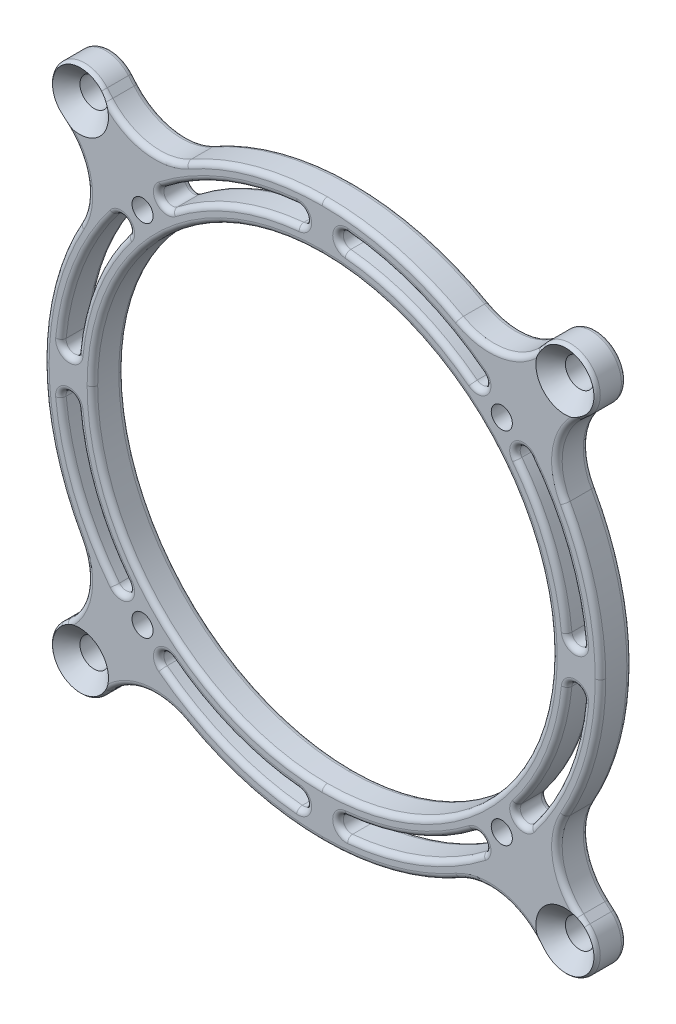
from build123d import *

# Parameters (mm, degrees)
BOSS_EXTRU_2_DEPTH                               = 3
CONG_2_R                                         = 0.5
D_GAGEMENT_M21_D                                 = 2
FRAISAGE_POUR_VIS_T_TE_FRAIS_E_M2_51_D           = 2.7
FRAISAGE_POUR_VIS_T_TE_FRAIS_E_M2_51_CSINK_D     = 5.5
FRAISAGE_POUR_VIS_T_TE_FRAIS_E_M2_51_CSINK_ANGLE = 90


# Read off the part's stored shape, not the designer's step: Symétrie1, Symétrie2
with BuildPart() as part:
    # Esquisse2 → Boss.-Extru.2 (new body)
    with BuildSketch(Plane.XY):
        with BuildLine():
            Line((24.879926139, -20.857950115), (24.281308749, -20.332585842))
            ThreePointArc((24.281308749, -20.332585842), (22.325409662, -16.837345209), (23.004734312, -12.890097263))
            ThreePointArc((23.004734312, -12.890097263), (25.514753504, -6.661063117), (26.369914832, 0))
            Line((26.369914832, 0), (21.769914832, 0))
            ThreePointArc((21.769914832, 0), (15.393654403, -15.393654403), (0, -21.769914832))
            Line((0, -21.769914832), (0, -26.369914832))
            ThreePointArc((0, -26.369914832), (6.661063117, -25.514753504), (12.890097263, -23.004734312))
            ThreePointArc((12.890097263, -23.004734312), (16.837345209, -22.325409662), (20.332585842, -24.281308749))
            Line((20.332585842, -24.281308749), (20.857950115, -24.879926139))
            ThreePointArc((20.857950115, -24.879926139), (25.015254326, -25.015254326), (24.879926139, -20.857950115))
        make_face()
        with BuildLine():
            ThreePointArc((2.376443976, -24.756113947), (9.134830733, -23.131526781), (15.179650803, -19.70002196))
            ThreePointArc((15.179650803, -19.70002196), (15.325059299, -18.578034274), (14.203071613, -18.432625777))
            ThreePointArc((14.203071613, -18.432625777), (8.547143591, -21.643365559), (2.223556024, -23.1634353))
            ThreePointArc((2.223556024, -23.1634353), (1.503660676, -24.0362186), (2.376443976, -24.756113947))
        make_face(mode=Mode.SUBTRACT)
        with BuildLine():
            ThreePointArc((24.756113947, -2.376443976), (23.131526781, -9.134830733), (19.70002196, -15.179650803))
            ThreePointArc((19.70002196, -15.179650803), (18.578034274, -15.325059299), (18.432625777, -14.203071613))
            ThreePointArc((18.432625777, -14.203071613), (21.643365559, -8.547143591), (23.1634353, -2.223556024))
            ThreePointArc((23.1634353, -2.223556024), (24.0362186, -1.503660676), (24.756113947, -2.376443976))
        make_face(mode=Mode.SUBTRACT)
    extrude(amount=BOSS_EXTRU_2_DEPTH)

    # Congé2
    cong_2_edges = [part.edges().sort_by_distance(p)[0] for p in [
        (22.325409662, -16.837345209, 0),
        (24.580617444, -20.595267979, 0),
        (25.015254326, -25.015254326, 0),
        (20.595267979, -24.580617444, 0),
        (16.837345209, -22.325409662, 0),
        (6.661063117, -25.514753504, 0),
        (15.393654403, -15.393654403, 3),
        (15.393654403, -15.393654403, 0),
        (25.514753504, -6.661063117, 0),
        (6.661063117, -25.514753504, 3),
        (16.837345209, -22.325409662, 3),
        (20.595267979, -24.580617444, 3),
        (1.503660676, -24.0362186, 0),
        (9.134830733, -23.131526781, 0),
        (15.325059299, -18.578034274, 0),
        (8.547143591, -21.643365559, 0),
        (1.503660676, -24.0362186, 3),
        (9.134830733, -23.131526781, 3),
        (15.325059299, -18.578034274, 3),
        (8.547143591, -21.643365559, 3),
        (25.015254326, -25.015254326, 3),
        (24.580617444, -20.595267979, 3),
        (22.325409662, -16.837345209, 3),
        (24.0362186, -1.503660676, 0),
        (21.643365559, -8.547143591, 0),
        (18.578034274, -15.325059299, 0),
        (23.131526781, -9.134830733, 0),
        (24.0362186, -1.503660676, 3),
        (21.643365559, -8.547143591, 3),
        (18.578034274, -15.325059299, 3),
        (23.131526781, -9.134830733, 3),
        (25.514753504, -6.661063117, 3),
    ]]
    fillet(cong_2_edges, radius=CONG_2_R)

    # Dégagement M21 (through all)
    with Locations(Plane(origin=(0, 0, 0), x_dir=(-1, 0, 0), z_dir=(0, 0, -1))):
        with Locations((-17.02, -17.02)):
            Hole(D_GAGEMENT_M21_D / 2)

    # Fraisage pour vis à tête fraisée M2.51 (through all)
    with Locations(Plane(origin=(0, 0, 3), x_dir=(-1, 0, 0), z_dir=(0, 0, 1))):
        with Locations((-23, 23)):
            CounterSinkHole(FRAISAGE_POUR_VIS_T_TE_FRAIS_E_M2_51_D / 2, FRAISAGE_POUR_VIS_T_TE_FRAIS_E_M2_51_CSINK_D / 2, counter_sink_angle=FRAISAGE_POUR_VIS_T_TE_FRAIS_E_M2_51_CSINK_ANGLE)

    # Symétrie1: part across plane


with BuildPart() as part_1:
    add(part.part)
    add(part.part.mirror(Plane.ZX))

    # Symétrie2: part across plane


with BuildPart() as part_2:
    add(part_1.part)
    add(part_1.part.mirror(Plane(origin=(0, 0, 0), x_dir=(0, 0, 1), z_dir=(1, 0, 0))))


solid = part_2.part
